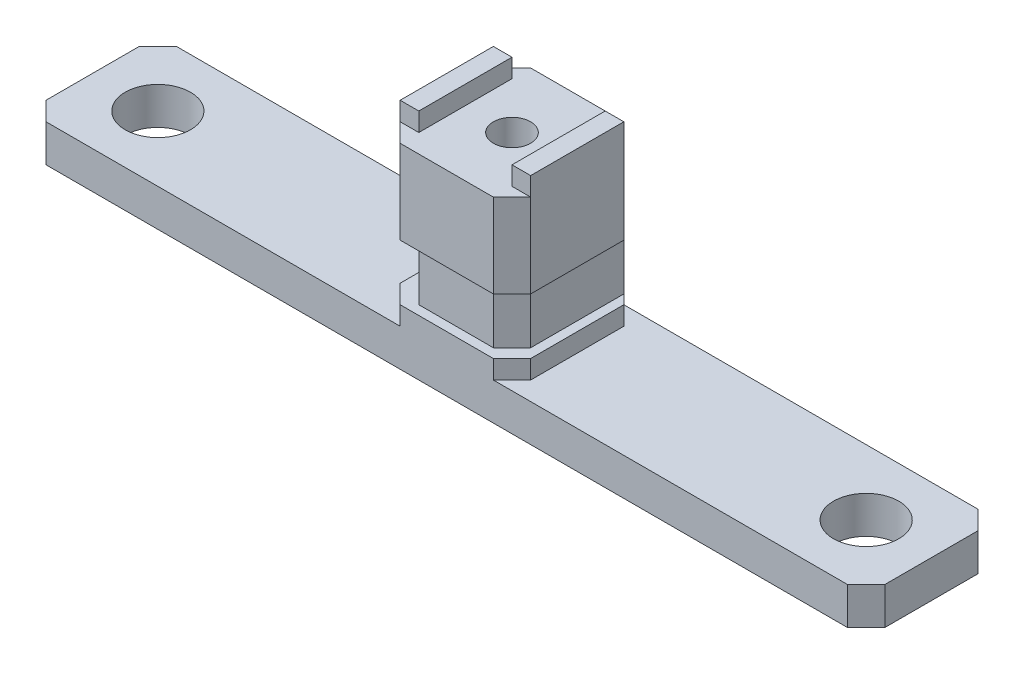
from build123d import *

# Parameters (mm, degrees)
SKETCH1_W           = 90
SKETCH1_H           = 14
SKETCH1_R           = 2
SKETCH1_R_2         = 3.5
BOSS_EXTRUDE1_DEPTH = 4
SKETCH2_W           = 14
SKETCH2_H           = 14
BOSS_EXTRUDE2_DEPTH = 2
SKETCH3_W           = 12
SKETCH3_H           = 12
BOSS_EXTRUDE3_DEPTH = 6
SKETCH4_W           = 14
SKETCH4_H           = 14
BOSS_EXTRUDE4_DEPTH = 9
SKETCH5_W           = 2
SKETCH5_H           = 10
BOSS_EXTRUDE5_DEPTH = 2
SKETCH6_R           = 2
CUT_EXTRUDE1_DEPTH  = 9
SKETCH8_R           = 4
SKETCH8_R_2         = 2
CUT_EXTRUDE2_DEPTH  = 48.095647357
CHAMFER1_SIZE       = 2
CHAMFER2_SIZE       = 2


with BuildPart() as part:
    # Sketch1 → Boss-Extrude1 (new body)
    # profile 1 of 2: a face of its own
    with BuildSketch(Plane(origin=(0, 0, 0), x_dir=(1, 0, 0), z_dir=(0, 1, 0))):
        Rectangle(SKETCH1_W, SKETCH1_H)
        Circle(SKETCH1_R, mode=Mode.SUBTRACT)
        with Locations(Location((38, 0, 0), (0, 0, 270))):
            Circle(SKETCH1_R_2, mode=Mode.SUBTRACT)
        with Locations(Location((-38, 0, 0), (0, 0, 270))):
            Circle(SKETCH1_R_2, mode=Mode.SUBTRACT)
    # profile 2 of 2: a face of its own
    with BuildSketch(Plane(origin=(0, 0, 0), x_dir=(1, 0, 0), z_dir=(0, 1, 0))):
        Circle(SKETCH1_R)
    extrude(amount=BOSS_EXTRUDE1_DEPTH)

    # Sketch2 → Boss-Extrude2 (add)
    with BuildSketch(Plane(origin=(0, 4, 0), x_dir=(1, 0, 0), z_dir=(0, 1, 0))):
        Rectangle(SKETCH2_W, SKETCH2_H)
    extrude(amount=BOSS_EXTRUDE2_DEPTH)

    # Sketch3 → Boss-Extrude3 (add)
    with BuildSketch(Plane(origin=(0, 6, 0), x_dir=(1, 0, 0), z_dir=(0, 1, 0))):
        Rectangle(SKETCH3_W, SKETCH3_H)
    extrude(amount=BOSS_EXTRUDE3_DEPTH)

    # Sketch4 → Boss-Extrude4 (add)
    with BuildSketch(Plane(origin=(0, 12, 0), x_dir=(1, 0, 0), z_dir=(0, 1, 0))):
        Rectangle(SKETCH4_W, SKETCH4_H)
    extrude(amount=BOSS_EXTRUDE4_DEPTH)

    # Sketch5 → Boss-Extrude5 (add)
    with BuildSketch(Plane(origin=(0, 21, 0), x_dir=(1, 0, 0), z_dir=(0, 1, 0))):
        with Locations((-6, 0)):
            Rectangle(SKETCH5_W, SKETCH5_H)
        with Locations((6, 0)):
            Rectangle(SKETCH5_W, SKETCH5_H)
    extrude(amount=BOSS_EXTRUDE5_DEPTH)

    # Sketch6 → Cut-Extrude1 (cut)
    with BuildSketch(Plane(origin=(0, 21, 0), x_dir=(1, 0, 0), z_dir=(0, 1, 0))):
        with Locations(Location((0, 0, 0), (0, 0, 270))):
            Circle(SKETCH6_R)
    extrude(amount=-CUT_EXTRUDE1_DEPTH, mode=Mode.SUBTRACT)

    # Sketch8 → Cut-Extrude2 (cut, through all)
    # profile 1 of 2: a face of its own
    with BuildSketch(Plane(origin=(0, 12, 0), x_dir=(1, 0, 0), z_dir=(0, 1, 0))):
        with Locations(Location((0, 0, 0), (0, 0, 270))):
            Circle(SKETCH8_R)
        with Locations(Location((0, 0, 0), (0, 0, 270))):
            Circle(SKETCH8_R_2, mode=Mode.SUBTRACT)
    # profile 2 of 2: a face of its own
    with BuildSketch(Plane(origin=(0, 12, 0), x_dir=(1, 0, 0), z_dir=(0, 1, 0))):
        with Locations(Location((0, 0, 0), (0, 0, 270))):
            Circle(SKETCH8_R_2)
    extrude(amount=-CUT_EXTRUDE2_DEPTH, mode=Mode.SUBTRACT)

    # Chamfer1
    chamfer1_edges = [part.edges().sort_by_distance(p)[0] for p in [
        (7, 5, 7),
        (6, 9, 6),
        (7, 16.5, 7),
        (7, 16.5, -7),
        (7, 5, -7),
        (-7, 5, 7),
        (-7, 5, -7),
        (-6, 9, -6),
        (-6, 9, 6),
        (-7, 16.5, 7),
        (45, 2, 7),
        (-45, 2, 7),
        (-45, 2, -7),
        (45, 2, -7),
        (-7, 16.5, -7),
    ]]
    chamfer(chamfer1_edges, length=CHAMFER1_SIZE - 0.0001)  # a hair under: the kernel refuses the full size

    # Chamfer2
    chamfer2_edges = [part.edges().sort_by_distance(p)[0] for p in [
        (0, 12, -2),
    ]]
    chamfer(chamfer2_edges, length=CHAMFER2_SIZE - 0.0001)  # a hair under: the kernel refuses the full size


solid = part.part
